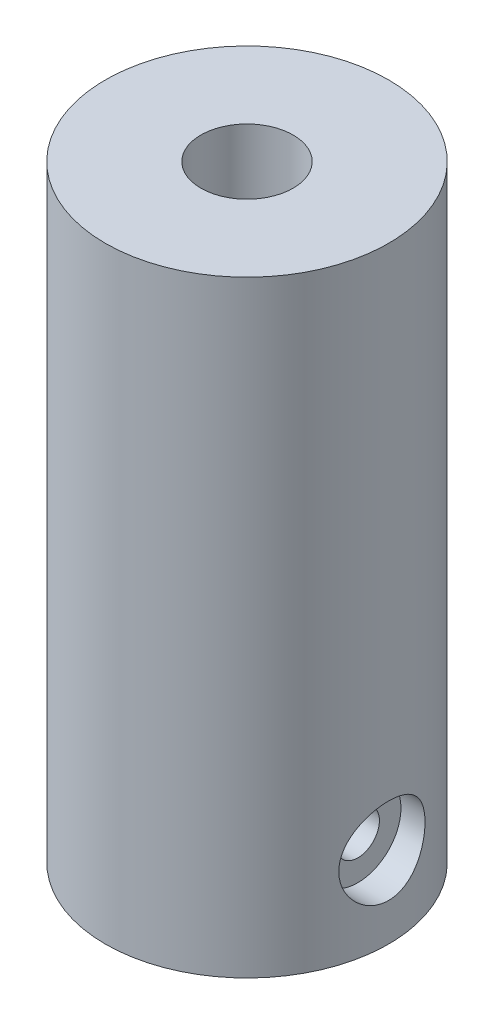
from build123d import *

# Parameters (mm, degrees)
SKETCH1_R                  = 8.89
BOSS_EXTRUDE1_DEPTH        = 38.1
F_3_0MM_DOWEL_HOLE2_D      = 3.5
F_12_CLEARANCE_HOLE1_D     = 5.7912
F_12_CLEARANCE_HOLE1_DEPTH = 19.05
F_12_CLEARANCE_HOLE1_TIP   = 1.739852008


# Read off the part's stored shape, not the designer's step: CBORE for #2 Button Head Cap Screw1
with BuildPart() as part:
    # Sketch1 → Boss-Extrude1 (new body)
    with BuildSketch(Plane(origin=(0, 0, 0), x_dir=(1, 0, 0), z_dir=(0, 1, 0))):
        with Locations(Location((0, 0, 0), (0, 0, 90))):
            Circle(SKETCH1_R)
    extrude(amount=BOSS_EXTRUDE1_DEPTH)

    # Ø3.0mm Dowel Hole2 (through all)
    with Locations(Plane(origin=(0, 38.1, 0), x_dir=(1, 0, 0), z_dir=(0, 1, 0))):
        with Locations((0, 0)):
            Hole(F_3_0MM_DOWEL_HOLE2_D / 2)

    # CBORE for #2 Button Head Cap Screw1 outl → CBORE for #2 Button Head Cap Screw1 (revolve, cut)
    with BuildSketch(Plane(origin=(0, 5.08, 0), x_dir=(0, 1, 0), z_dir=(0, 0, -1))):
        Polygon((1.35255, 6.9596), (2.70637, 6.9596), (2.70637, 8.890055176), (0, 8.890055176), (0, 1.110061146), (1.35255, 1.110061146), align=None)
    revolve(axis=Axis((0, 5.08, 0), (1, 0, 0)), mode=Mode.SUBTRACT)

    # #12 Clearance Hole1
    with Locations(Plane(origin=(0, 38.1, 0), x_dir=(1, 0, 0), z_dir=(0, 1, 0))):
        with Locations((0, 0)):
            Hole(F_12_CLEARANCE_HOLE1_D / 2, depth=F_12_CLEARANCE_HOLE1_DEPTH)
            with Locations((0, 0, -(F_12_CLEARANCE_HOLE1_DEPTH + F_12_CLEARANCE_HOLE1_TIP / 2))):  # 118° drill point
                Cone(0, F_12_CLEARANCE_HOLE1_D / 2, F_12_CLEARANCE_HOLE1_TIP, mode=Mode.SUBTRACT)


solid = part.part
